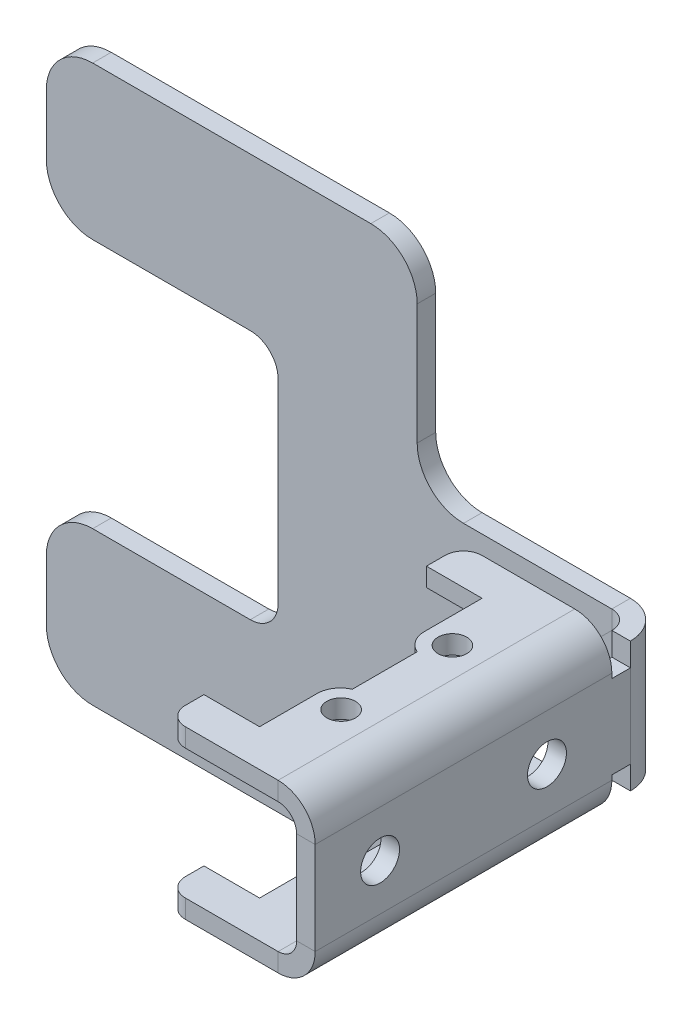
from build123d import *

# Parameters (mm, degrees)
BOSS_EXTRU_1_DEPTH        = 32
ESQUISSE2_R               = 1.55
ENL_V_MAT_EXTRU_1_DEPTH   = 39.052595181
ESQUISSE3_W               = 1.5
ESQUISSE3_H               = 7
ENL_V_MAT_EXTRU_2_DEPTH   = 39.052595181
ESQUISSE4_W               = 4
ESQUISSE4_H               = 2
BOSS_EXTRU_2_DEPTH        = 6
CONG_1_R                  = 2.5
CONG_2_R                  = 2
ESQUISSE13_R              = 2.1
ENL_V_MAT_EXTRU_3_DEPTH   = 40.293765409
ESQUISSE14_W              = 2
ESQUISSE14_H              = 14
BOSS_EXTRU_3_DEPTH        = 4
BOSS_EXTRU_4_START        = -14
ESQUISSE15_W              = 25
ESQUISSE15_H              = 2
BOSS_EXTRU_4_DEPTH        = 14
BOSS_EXTRU_5_START        = -2
BOSS_EXTRU_5_DEPTH        = 2
CONG_5_R                  = 5
CONG_6_R                  = 3
ESQUISSE26_W              = 2
ESQUISSE26_H              = 2.5
ENL_V_MAT_EXTRU_5_DEPTH   = 83.280009723
CONVERTIR_VOLUME3_DEPTH   = 32
CONVERTIR_VOLUME3_START   = 2
CONVERTIR_VOLUME3_2_DEPTH = 14
CONVERTIR_VOLUME3_3_DEPTH = 32
CONVERTIR_VOLUME3_START_2 = -6
CONVERTIR_VOLUME3_4_DEPTH = 2
CONVERTIR_VOLUME3_5_DEPTH = 14


# Read off the part's stored shape, not the designer's step: Convertir-Volume3
with BuildPart() as part:
    # Esquisse1 → Boss.-Extru.1 (new body)
    with BuildSketch(Plane.XY):
        Polygon((0, 0), (10, 0), (10, 18), (0, 18), (0, 16), (8, 16), (8, 2), (0, 2), align=None)
    extrude(amount=BOSS_EXTRU_1_DEPTH)

    # Esquisse2 → Enlèv. mat.-Extru.1 (cut, through all)
    with BuildSketch(Plane(origin=(0, 18, 0), x_dir=(1, 0, 0), z_dir=(0, 1, 0))):
        with Locations(Location((2.8, -10, 0), (0, 0, 270))):
            Circle(ESQUISSE2_R)
        with Locations((2.8, -22)):
            Circle(ESQUISSE2_R)
    extrude(amount=-ENL_V_MAT_EXTRU_1_DEPTH, mode=Mode.SUBTRACT)

    # Esquisse3 → Enlèv. mat.-Extru.2 (cut, through all)
    with BuildSketch(Plane(origin=(0, 18, 0), x_dir=(1, 0, 0), z_dir=(0, 1, 0))):
        with Locations((0.75, -16)):
            Rectangle(ESQUISSE3_W, ESQUISSE3_H)
    extrude(amount=-ENL_V_MAT_EXTRU_2_DEPTH, mode=Mode.SUBTRACT)

    # Esquisse4 → Boss.-Extru.2 (add)
    with BuildSketch(Plane.ZY):
        with Locations((2, 17)):
            Rectangle(ESQUISSE4_W, ESQUISSE4_H)
        with Locations((2, 1)):
            Rectangle(ESQUISSE4_W, ESQUISSE4_H)
        with Locations((30, 1)):
            Rectangle(ESQUISSE4_W, ESQUISSE4_H)
        with Locations((30, 17)):
            Rectangle(ESQUISSE4_W, ESQUISSE4_H)
    extrude(amount=BOSS_EXTRU_2_DEPTH)

    # Congé1
    # the kernel refuses this fillet: 2.5 mm, written as the material it takes off along each edge
    with BuildSketch(Plane(origin=(0, 7.728219619, 19.5), x_dir=(0, 0, 1), z_dir=(0, -1, 0)), Plane(origin=(0, 23.728219619, 19.5), x_dir=(0, 0, 1), z_dir=(0, -1, 0))) as cong_1_piece_1:
        with BuildLine():
            CenterArc((2.291287847, -2.5), CONG_1_R, 90, 66.421821522)
            Line((0, -1.5), (-0.045825757, -1.48))
            ThreePointArc((-0.045825757, -1.48), (-0.05, -0.75), (-0.05, 0))
            Line((-0.05, 0), (0, 0.05))
            Line((0, 0.05), (2.291287847, 0.05))
            Line((2.291287847, 0.05), (2.291287847, 0))
        make_face()
    extrude(amount=13.456439237, mode=Mode.SUBTRACT)
    with BuildSketch(Plane(origin=(0, 7.728219619, 12.5), x_dir=(1, 0, 0), z_dir=(0, -1, 0)), Plane(origin=(0, 23.728219619, 12.5), x_dir=(1, 0, 0), z_dir=(0, -1, 0))) as cong_1_piece_2:
        with BuildLine():
            CenterArc((2.5, -2.291287847), CONG_1_R, 113.578178478, 66.421821522)
            Line((0, -2.291287847), (-0.05, -2.291287847))
            Line((-0.05, -2.291287847), (-0.05, 0))
            Line((-0.05, 0), (0, 0.05))
            ThreePointArc((0, 0.05), (0.75, 0.05), (1.48, 0.045825757))
            Line((1.48, 0.045825757), (1.5, 0))
        make_face()
    extrude(amount=13.456439237, mode=Mode.SUBTRACT)

    # Congé2
    cong_2_edges = [part.edges().sort_by_distance(p)[0] for p in [
        (-6, 17, 32),
        (-6, 17, 0),
        (-6, 1, 0),
        (-6, 1, 32),
    ]]
    fillet(cong_2_edges, radius=CONG_2_R)

    # Esquisse13 → Enlèv. mat.-Extru.3 (cut, through all)
    with BuildSketch(Plane.ZY.offset(-8)):
        with Locations(Location((7, 9, 0), (0, 0, 270))):
            Circle(ESQUISSE13_R)
        with Locations(Location((25, 9, 0), (0, 0, 90))):
            Circle(ESQUISSE13_R)
    extrude(amount=-ENL_V_MAT_EXTRU_3_DEPTH, mode=Mode.SUBTRACT)

    # Esquisse14 → Boss.-Extru.3 (add)
    with BuildSketch(Plane(origin=(0, 0, 0), x_dir=(-1, 0, 0), z_dir=(0, 0, -1))):
        with Locations((-9, 9)):
            Rectangle(ESQUISSE14_W, ESQUISSE14_H)
    extrude(amount=BOSS_EXTRU_3_DEPTH)

    # Esquisse15 → Boss.-Extru.4 (add)
    with BuildSketch(Plane.XZ.offset(-2).offset(BOSS_EXTRU_4_START)):
        with Locations((-2.5, -5)):
            Rectangle(ESQUISSE15_W, ESQUISSE15_H)
    extrude(amount=BOSS_EXTRU_4_DEPTH)

    # Esquisse16 → Boss.-Extru.5 (add)
    with BuildSketch(Plane(origin=(0, 0, -6), x_dir=(-1, 0, 0), z_dir=(0, 0, -1)).offset(BOSS_EXTRU_5_START)):
        Polygon((15, 16), (15, 39), (55, 39), (55, 22.5), (30, 22.5), (30, -4.5), (55, -4.5), (55, -21), (15, -21), (15, 2), align=None)
    extrude(amount=BOSS_EXTRU_5_DEPTH)

    # Congé5
    cong_5_edges = [part.edges().sort_by_distance(p)[0] for p in [
        (-15, 16, -5),
        (-15, 2, -5),
        (-15, -21, -5),
        (-15, 39, -5),
        (-55, 39, -5),
        (-55, 22.5, -5),
        (-55, -4.5, -5),
        (-55, -21, -5),
    ]]
    fillet(cong_5_edges, radius=CONG_5_R)

    # Congé6
    cong_6_edges = [part.edges().sort_by_distance(p)[0] for p in [
        (-30, 22.5, -5),
        (-30, -4.5, -5),
    ]]
    fillet(cong_6_edges, radius=CONG_6_R)

    # Esquisse26 → Enlèv. mat.-Extru.5 (cut, through all)
    with BuildSketch(Plane(origin=(10, 0, 0), x_dir=(0, 0, -1), z_dir=(1, 0, 0))):
        with Locations((1, 3.25)):
            Rectangle(ESQUISSE26_W, ESQUISSE26_H)
        with Locations((1, 14.75)):
            Rectangle(ESQUISSE26_W, ESQUISSE26_H)
    extrude(amount=-ENL_V_MAT_EXTRU_5_DEPTH, mode=Mode.SUBTRACT)

    # Convertir-Volume3 outline → Convertir-Volume3 (add)
    with BuildSketch(Plane.XY):
        with BuildLine():
            ThreePointArc((6, 16), (7.414213562, 15.414213562), (8, 14))
            Line((8, 14), (8, 16))
            Line((8, 16), (6, 16))
        make_face()
        with BuildLine():
            Line((8, 2), (8, 4))
            ThreePointArc((8, 4), (7.414213562, 2.585786438), (6, 2))
            Line((6, 2), (8, 2))
        make_face()
    extrude(amount=CONVERTIR_VOLUME3_DEPTH)

    # Convertir-Volume3 2 outline → Convertir-Volume3 2 (add)
    with BuildSketch(Plane(origin=(0, 0, 0), x_dir=(1, 0, 0), z_dir=(0, 1, 0)).offset(CONVERTIR_VOLUME3_START)):
        with BuildLine():
            ThreePointArc((6, 4), (7.414213562, 3.414213562), (8, 2))
            Line((8, 2), (8, 4))
            Line((8, 4), (6, 4))
        make_face()
    extrude(amount=CONVERTIR_VOLUME3_2_DEPTH)

    # Convertir-Volume3 3 outline → Convertir-Volume3 3 (cut)
    with BuildSketch(Plane.XY):
        with BuildLine():
            Line((10, 14), (10, 18))
            Line((10, 18), (6, 18))
            ThreePointArc((6, 18), (8.828427125, 16.828427125), (10, 14))
        make_face()
        with BuildLine():
            Line((10, 0), (10, 4))
            ThreePointArc((10, 4), (8.828427125, 1.171572875), (6, 0))
            Line((6, 0), (10, 0))
        make_face()
    extrude(amount=CONVERTIR_VOLUME3_3_DEPTH, mode=Mode.SUBTRACT)

    # Convertir-Volume3 4 outline → Convertir-Volume3 4 (cut)
    with BuildSketch(Plane.XY.offset(CONVERTIR_VOLUME3_START_2)):
        with BuildLine():
            Line((10, 16), (9.464101616, 16))
            ThreePointArc((9.464101616, 16), (9.863703305, 15.03527618), (10, 14))
            Line((10, 14), (10, 16))
        make_face()
        with BuildLine():
            ThreePointArc((10, 4), (9.863703305, 2.96472382), (9.464101616, 2))
            Line((9.464101616, 2), (10, 2))
            Line((10, 2), (10, 4))
        make_face()
    extrude(amount=CONVERTIR_VOLUME3_4_DEPTH, mode=Mode.SUBTRACT)

    # Convertir-Volume3 5 outline → Convertir-Volume3 5 (cut)
    with BuildSketch(Plane(origin=(0, 0, 0), x_dir=(1, 0, 0), z_dir=(0, 1, 0)).offset(CONVERTIR_VOLUME3_START)):
        with BuildLine():
            ThreePointArc((6, 6), (8.828427125, 4.828427125), (10, 2))
            Line((10, 2), (10, 6))
            Line((10, 6), (6, 6))
        make_face()
    extrude(amount=CONVERTIR_VOLUME3_5_DEPTH, mode=Mode.SUBTRACT)


solid = part.part
